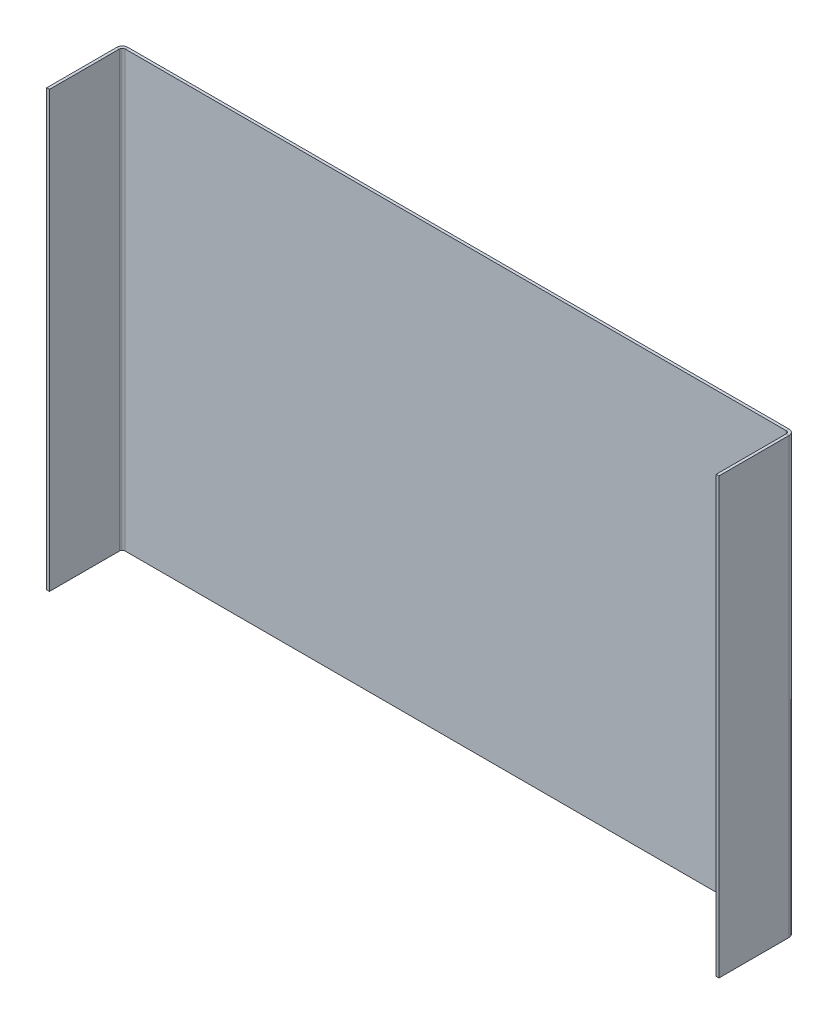
from build123d import *

# Parameters (mm, degrees)
BASE_FLANGE1_DEPTH = 115


# Sheet-metal steps are written as plain solids
with BuildPart() as part:
    # Sketch1 → Base-Flange1 (new body)
    with BuildSketch(Plane(origin=(0, 0, 0), x_dir=(1, 0, 0), z_dir=(0, 1, 0))):
        with BuildLine():
            Line((0, 0), (0, 18.5268))
            ThreePointArc((0, 18.5268), (0.43149029, 19.56850971), (1.4732, 20))
            Line((1.4732, 20), (176.3268, 20))
            ThreePointArc((176.3268, 20), (177.36850971, 19.56850971), (177.8, 18.5268))
            Line((177.8, 18.5268), (177.8, 0))
            Line((177.8, 0), (177.0634, 0))
            Line((177.0634, 0), (177.0634, 18.5268))
            ThreePointArc((177.0634, 18.5268), (176.847654855, 19.047654855), (176.3268, 19.2634))
            Line((176.3268, 19.2634), (1.4732, 19.2634))
            ThreePointArc((1.4732, 19.2634), (0.952345145, 19.047654855), (0.7366, 18.5268))
            Line((0.7366, 18.5268), (0.7366, 0))
            Line((0.7366, 0), (0, 0))
        make_face()
    extrude(amount=BASE_FLANGE1_DEPTH)


solid = part.part
